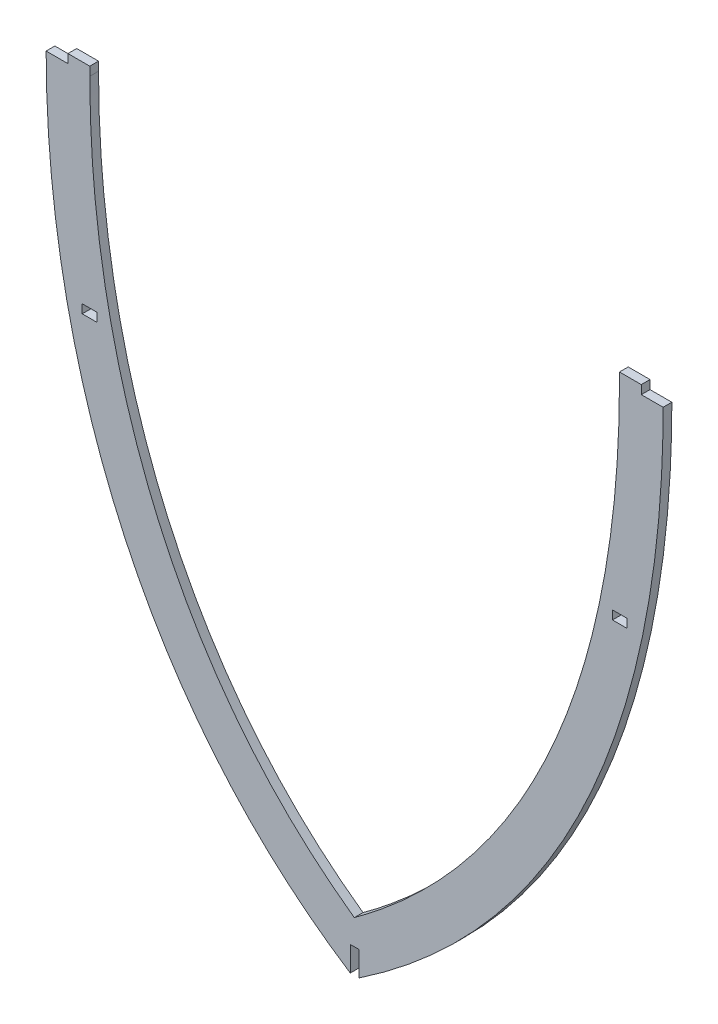
from build123d import *

# Parameters (mm, degrees)
SKETCH1_W           = 5
SKETCH1_H           = 3
BOSS_EXTRUDE1_DEPTH = 1.5
SKETCH2_W           = 3
SKETCH2_H           = 9.494035225
CUT_EXTRUDE1_DEPTH  = 3


with BuildPart() as part:
    # Sketch1 → Boss-Extrude1 (new, symmetric)
    with BuildSketch(Plane.XY):
        with BuildLine():
            Line((-106, -83), (-98.5, -83))
            Line((-98.5, -83), (-98.5, -80))
            Line((-98.5, -80), (-91, -80))
            Line((-91, -80), (-91, -83))
            add(Edge.make_bspline(
                [(-91, -83), (-91, -88.068550738), (-90.784224975, -98.220481237), (-89.471687929, -118.377767284), (-86.146815137, -143.230800289), (-79.368059247, -172.071120858), (-69.71738881, -199.531988745), (-57.11831244, -225.231718508), (-44.09611353, -244.888891231), (-32.112008883, -259.401886537), (-22.324804426, -269.642683196), (-13.48110772, -277.613388782), (-5.992695326, -283.625797901), (-2.089373231, -286.521065709), (-0.116739636, -287.926353347)],
                knots=[0, 0, 0, 0, 0.059983469, 0.119966937, 0.239933875, 0.359900812, 0.47986775, 0.599834687, 0.719801625, 0.779785093, 0.839768562, 0.899752031, 0.929743765, 0.9597355, 0.9597355, 0.9597355, 0.9597355], degree=3))
            add(Edge.make_bspline(
                [(-0.116739636, -287.926353347), (1.870810322, -286.480217138), (5.811438827, -283.506382084), (13.355962702, -277.384642576), (22.257609381, -269.345287034), (32.090104582, -259.121737951), (44.109675826, -244.741072781), (57.139620096, -225.411627313), (69.725154077, -200.204558319), (79.363006417, -173.160517049), (85.009288934, -149.261906753), (88.135960804, -129.439309105), (89.796426225, -114.252560891), (90.618872692, -101.350995082), (90.945843548, -90.910045133), (91, -85.632026579), (91, -83)],
                knots=[0, 0, 0, 0, 0.030008035, 0.060016069, 0.120032138, 0.180048207, 0.240064276, 0.360096414, 0.480128553, 0.600160691, 0.720192829, 0.780208898, 0.840224967, 0.900241036, 0.930249071, 0.960257105, 0.960257105, 0.960257105, 0.960257105], degree=3))
            Line((91, -83), (91, -80))
            Line((91, -80), (98.5, -80))
            Line((98.5, -80), (98.5, -83))
            Line((98.5, -83), (106, -83))
            add(Edge.make_bspline(
                [(106, -83), (106, -174.443319162), (74.762940933, -256.782973383), (0, -306.089272366)],
                knots=[0, 0, 0, 0, 1, 1, 1, 1], degree=3))
            add(Edge.make_bspline(
                [(-106, -83), (-106, -171.171703539), (-74.762940933, -258.439171973), (0, -306.089272366)],
                knots=[0, 0, 0, 0, 1, 1, 1, 1], degree=3))
        make_face()
        with Locations((-91.1, -153.5)):
            Rectangle(SKETCH1_W, SKETCH1_H, mode=Mode.SUBTRACT)
        with Locations((91.1, -153.5)):
            Rectangle(SKETCH1_W, SKETCH1_H, mode=Mode.SUBTRACT)
    extrude(amount=BOSS_EXTRUDE1_DEPTH, both=True)

    # Sketch2 → Cut-Extrude1 (cut)
    with BuildSketch(Plane.XY.offset(1.5)):
        with Locations((0, -301.342254754)):
            Rectangle(SKETCH2_W, SKETCH2_H)
    extrude(amount=-CUT_EXTRUDE1_DEPTH, mode=Mode.SUBTRACT)


solid = part.part
